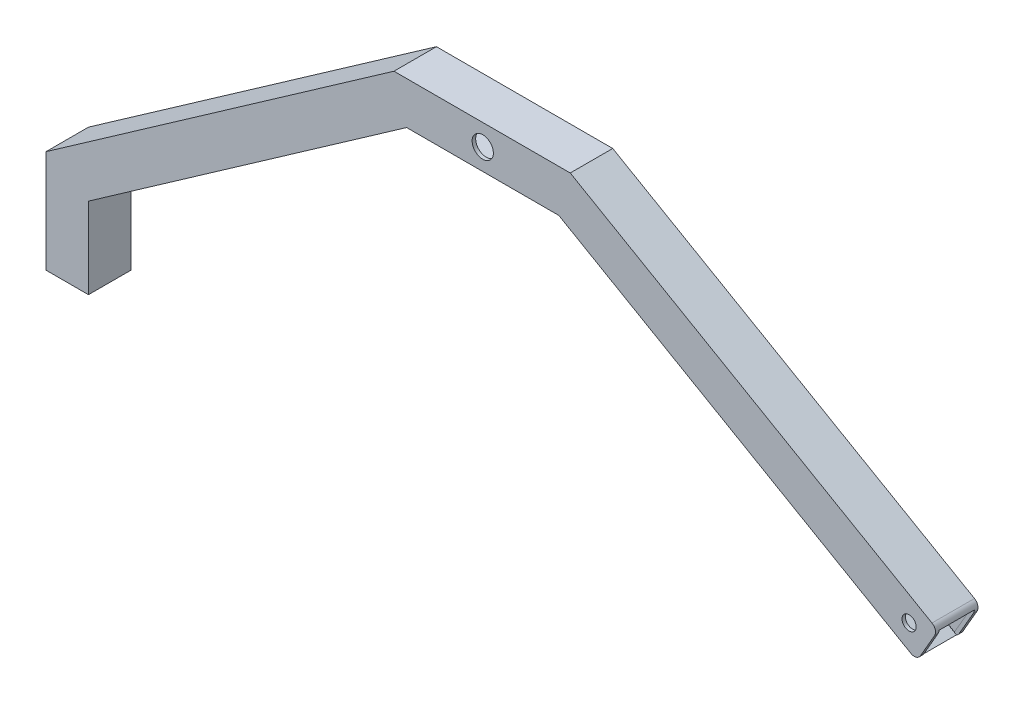
from build123d import *

# Parameters (mm, degrees)
BOSS_EXTRUDE1_DEPTH = 12
SHELL1_T            = -1
SKETCH3_R           = 3
SKETCH3_R_2         = 2
CUT_EXTRUDE1_DEPTH  = 12
SKETCH4_W           = 10
SKETCH4_H           = 10
CUT_EXTRUDE2_DEPTH  = 12
FILLET1_R           = 2


with BuildPart() as part:
    # Sketch2 → Boss-Extrude1 (new body)
    with BuildSketch(Plane.XY):
        Polygon((-28.002919882, 3.210239845), (-126.301165196, -65.618932518), (-126.301165196, -94.618932518), (-114.301165196, -94.618932518), (-114.301165196, -71.722772739), (-24.421364281, -8.788258605), (18.577059182, -8.788258605), (119.718098707, -67.182065001), (125.718098707, -56.789760155), (21.795050253, 3.210239845), align=None)
    extrude(amount=BOSS_EXTRUDE1_DEPTH)

    # Shell1
    shell1_openings = [part.faces().sort_by_distance(p)[0] for p in [
        (-120.301165196, -94.618932518, 6),
    ]]
    offset(amount=SHELL1_T, openings=shell1_openings, kind=Kind.INTERSECTION)

    # Sketch3 → Cut-Extrude1 (cut)
    with BuildSketch(Plane.XY.offset(12)):
        with Locations((-2.922152549, -2.788258605)):
            Circle(SKETCH3_R)
        with Locations((117.521946284, -58.985912578)):
            Circle(SKETCH3_R_2)
    extrude(amount=-CUT_EXTRUDE1_DEPTH, mode=Mode.SUBTRACT)

    # Sketch4 → Cut-Extrude2 (cut)
    with BuildSketch(Plane(origin=(118.879261515, -68.634973637, 0), x_dir=(0, 0, -1), z_dir=(0.8660254037844357, -0.500000000000005, 0))):
        with Locations((-6.037142442, 7.633616623)):
            Rectangle(SKETCH4_W, SKETCH4_H)
    extrude(amount=-CUT_EXTRUDE2_DEPTH, mode=Mode.SUBTRACT)

    # Fillet1
    # the kernel refuses this fillet: 2 mm, written as the material it takes off along each edge
    with BuildSketch(Plane(origin=(119.718098707, -67.182065001, -5), x_dir=(0.499999999999999, 0.8660254037844393, 0), z_dir=(0, 0, 1)), Plane(origin=(125.718098707, -56.789760155, -5), x_dir=(-0.8660254037844393, 0.499999999999999, 0), z_dir=(0, 0, 1))) as fillet1_piece_1:
        with BuildLine():
            CenterArc((FILLET1_R, FILLET1_R), FILLET1_R, 180, 90)
            Line((0, FILLET1_R), (0, 0))
            Line((0, 0), (FILLET1_R, 0))
        make_face()
    extrude(amount=22, mode=Mode.SUBTRACT)


solid = part.part
